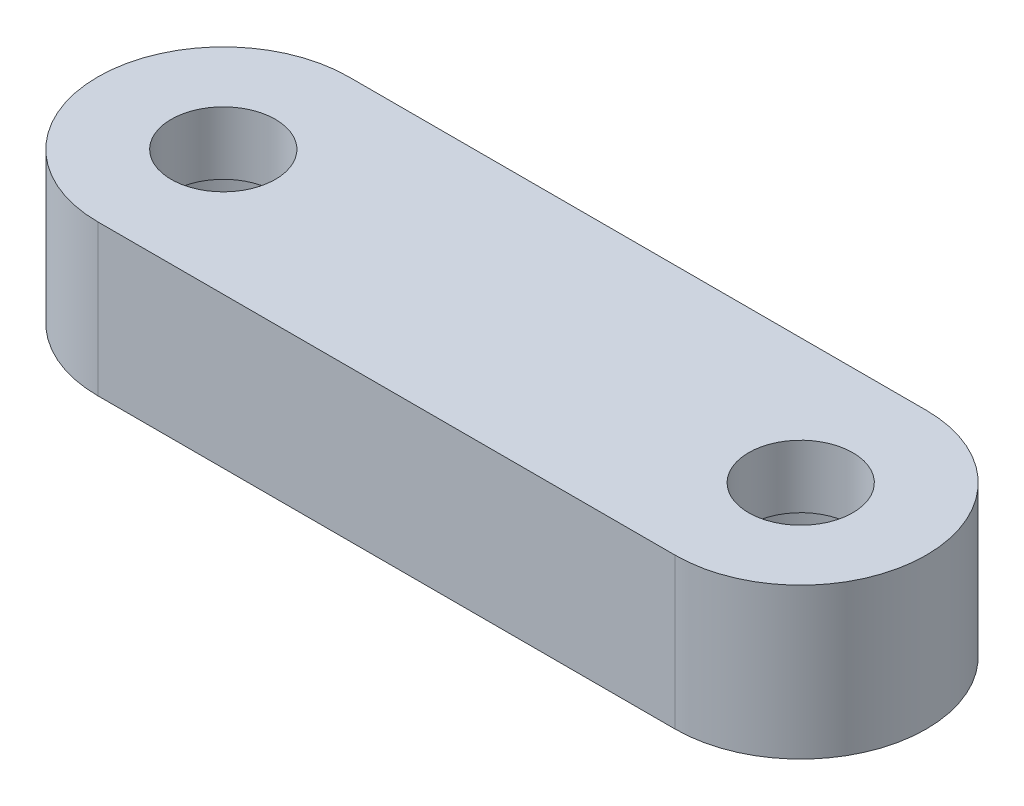
from build123d import *

# Parameters (mm, degrees)
BOSS_EXTRUDE1_DEPTH = 6


with BuildPart() as part:
    # Sketch2 → Boss-Extrude1 (new body)
    with BuildSketch(Plane(origin=(0, 0, 0), x_dir=(1, 0, 0), z_dir=(0, 1, 0))):
        with BuildLine():
            Line((0, 5), (23, 5))
            ThreePointArc((23, 5), (28, 0), (23, -5))
            Line((23, -5), (0, -5))
            ThreePointArc((0, -5), (-5, 0), (0, 5))
        make_face()
    extrude(amount=BOSS_EXTRUDE1_DEPTH)

    # Sketch3 → Cut-Revolve1 (revolve, cut)
    with BuildSketch(Plane.XY):
        Polygon((0, 0), (-3.75, 0), (-3.75, 3.5), (-2.075, 3.5), (-2.075, 6), (0, 6), align=None)
    revolve(axis=Axis((0, 0, 0), (0, 1, 0)), mode=Mode.SUBTRACT)

    # Sketch4 → Cut-Revolve2 (revolve, cut)
    with BuildSketch(Plane.XY):
        Polygon((23, 0), (19.25, 0), (19.25, 3.5), (20.925, 3.5), (20.925, 6), (23, 6), align=None)
    revolve(axis=Axis((23, 0, 0), (0, 1, 0)), mode=Mode.SUBTRACT)


solid = part.part
